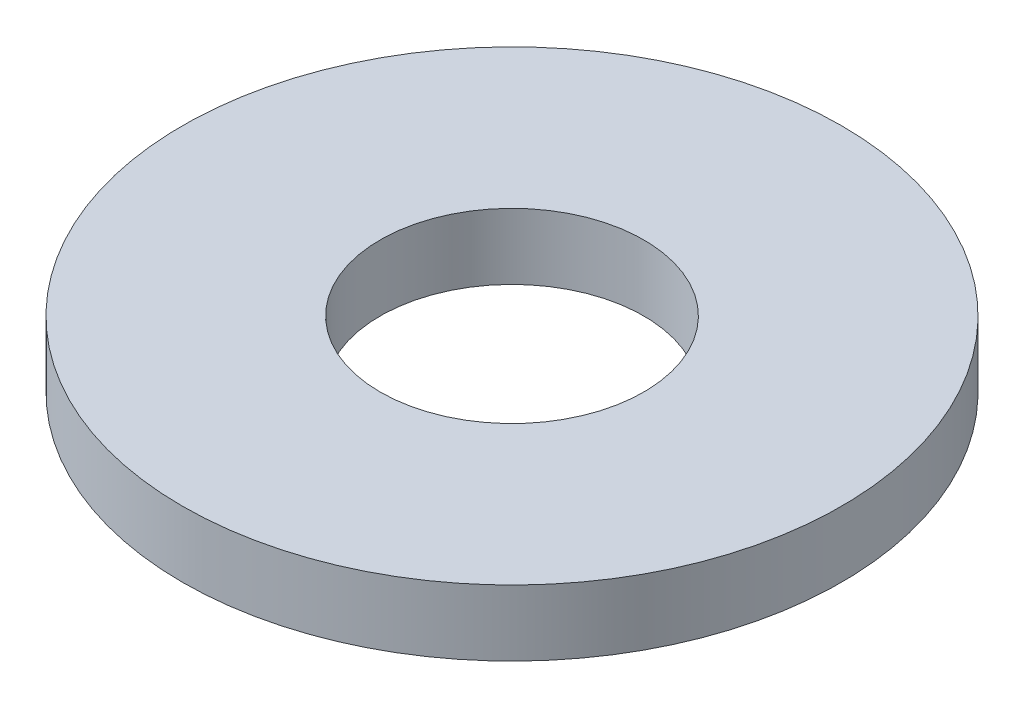
from build123d import *

# Parameters (mm, degrees)
SKETCH1_R           = 75
BOSS_EXTRUDE1_DEPTH = 15
SKETCH2_R           = 30
CUT_EXTRUDE1_DEPTH  = 108.121426428


with BuildPart() as part:
    # Sketch1 → Boss-Extrude1 (new body)
    with BuildSketch(Plane(origin=(0, 0, 0), x_dir=(1, 0, 0), z_dir=(0, 1, 0))):
        Circle(SKETCH1_R)
    extrude(amount=BOSS_EXTRUDE1_DEPTH)

    # Sketch2 → Cut-Extrude1 (cut, through all)
    with BuildSketch(Plane(origin=(0, 0, 0), x_dir=(1, 0, 0), z_dir=(0, 1, 0))):
        Circle(SKETCH2_R)
    extrude(amount=CUT_EXTRUDE1_DEPTH, mode=Mode.SUBTRACT)


solid = part.part
